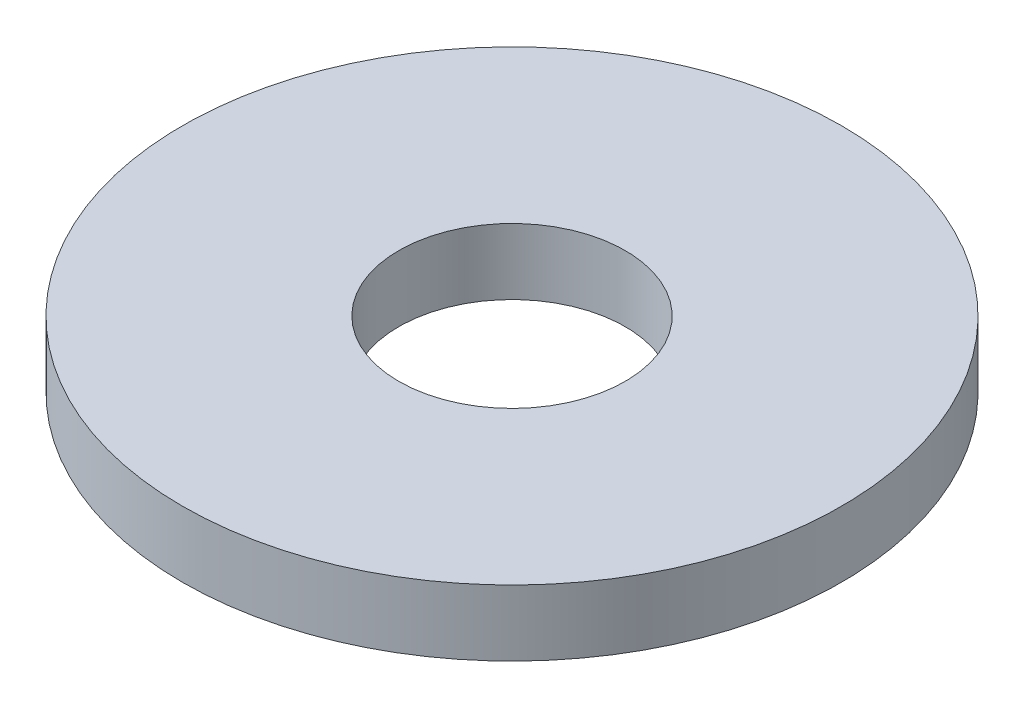
from build123d import *

# Parameters (mm, degrees)
SKETCH1_R           = 80
BOSS_EXTRUDE1_DEPTH = 16
SKETCH2_R           = 27.5
CUT_EXTRUDE1_DEPTH  = 115.262854857


with BuildPart() as part:
    # Sketch1 → Boss-Extrude1 (new body)
    with BuildSketch(Plane(origin=(0, 0, 0), x_dir=(1, 0, 0), z_dir=(0, 1, 0))):
        Circle(SKETCH1_R)
    extrude(amount=BOSS_EXTRUDE1_DEPTH)

    # Sketch2 → Cut-Extrude1 (cut, through all)
    with BuildSketch(Plane(origin=(0, 0, 0), x_dir=(1, 0, 0), z_dir=(0, 1, 0))):
        Circle(SKETCH2_R)
    extrude(amount=CUT_EXTRUDE1_DEPTH, mode=Mode.SUBTRACT)


solid = part.part
